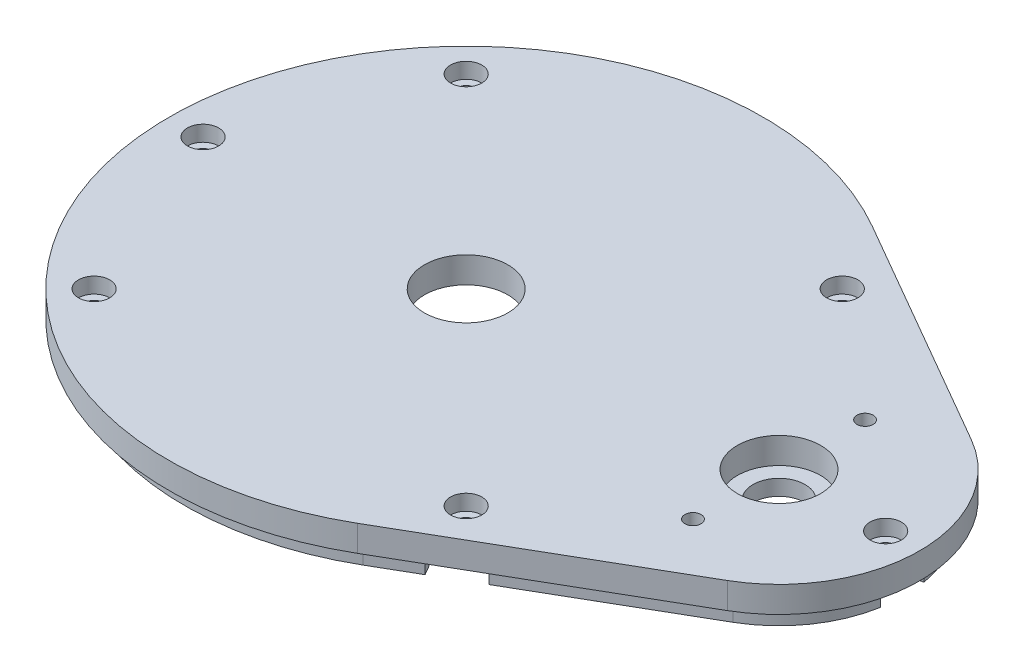
from build123d import *

# Parameters (mm, degrees)
SKETCH1_R           = 8
SKETCH1_R_2         = 1.55
BOSS_EXTRUDE1_DEPTH = 5
SKETCH2_R           = 12
SKETCH2_R_2         = 5
BOSS_EXTRUDE2_DEPTH = 3
BOSS_EXTRUDE3_DEPTH = 4
SKETCH5_R           = 1.55
CUT_EXTRUDE1_DEPTH  = 5
SKETCH6_R           = 3
CUT_EXTRUDE2_DEPTH  = 3


with BuildPart() as part:
    # Sketch1 → Boss-Extrude1 (new body)
    with BuildSketch(Plane(origin=(0, 0, 0), x_dir=(1, 0, 0), z_dir=(0, 1, 0))):
        with BuildLine():
            Line((13.5, -49.363448016), (58.5, -23.382685902))
            ThreePointArc((58.5, -23.382685902), (72, 0), (58.5, 23.382685902))
            Line((58.5, 23.382685902), (13.5, 49.363448016))
            ThreePointArc((13.5, 49.363448016), (-72, 0), (13.5, -49.363448016))
        make_face()
        with Locations((-15, 0)):
            Circle(SKETCH1_R, mode=Mode.SUBTRACT)
        with Locations((45, 0)):
            Circle(SKETCH1_R, mode=Mode.SUBTRACT)
        with Locations((45, 16.5)):
            Circle(SKETCH1_R_2, mode=Mode.SUBTRACT)
        with Locations((45, -16.5)):
            Circle(SKETCH1_R_2, mode=Mode.SUBTRACT)
    extrude(amount=BOSS_EXTRUDE1_DEPTH)

    # Sketch2 → Boss-Extrude2 (add)
    with BuildSketch(Plane.XZ):
        with Locations((45, 0)):
            Circle(SKETCH2_R)
        with Locations((45, 0)):
            Circle(SKETCH2_R_2, mode=Mode.SUBTRACT)
    extrude(amount=BOSS_EXTRUDE2_DEPTH)

    # Sketch4 → Boss-Extrude3 (add)
    with BuildSketch(Plane.XZ):
        with BuildLine():
            Line((12, -46.765371804), (19.534222953, -42.415486154))
            Line((19.534222953, -42.415486154), (18.534222953, -40.683435347))
            Line((18.534222953, -40.683435347), (11, -45.033320997))
            ThreePointArc((11, -45.033320997), (-19.532098623, -51.802124301), (-48.424955704, -39.834311042))
            Line((-48.424955704, -39.834311042), (-49.710530923, -41.366399928))
            ThreePointArc((-49.710530923, -41.366399928), (-19.706410108, -53.794513697), (12, -46.765371804))
        make_face()
        with BuildLine():
            Line((68.635386072, -4.167556264), (66.665770566, -3.820259909))
            ThreePointArc((66.665770566, -3.820259909), (63.021344974, -12.6186816), (56, -19.052558883))
            Line((56, -19.052558883), (26.328451587, -36.183435347))
            Line((26.328451587, -36.183435347), (27.328451587, -37.915486154))
            Line((27.328451587, -37.915486154), (57, -20.784609691))
            ThreePointArc((57, -20.784609691), (64.659649063, -13.765834472), (68.635386072, -4.167556264))
        make_face()
        with BuildLine():
            Line((66.665770566, 3.820259909), (68.635386072, 4.167556264))
            ThreePointArc((68.635386072, 4.167556264), (64.659649063, 13.765834472), (57, 20.784609691))
            Line((57, 20.784609691), (27.328451587, 37.915486154))
            Line((27.328451587, 37.915486154), (26.328451587, 36.183435347))
            Line((26.328451587, 36.183435347), (56, 19.052558883))
            ThreePointArc((56, 19.052558883), (63.021344974, 12.6186816), (66.665770566, 3.820259909))
        make_face()
        with BuildLine():
            Line((-49.710530923, 41.366399928), (-48.424955704, 39.834311042))
            ThreePointArc((-48.424955704, 39.834311042), (-19.532098623, 51.802124301), (11, 45.033320997))
            Line((11, 45.033320997), (18.534222953, 40.683435347))
            Line((18.534222953, 40.683435347), (19.534222953, 42.415486154))
            Line((19.534222953, 42.415486154), (12, 46.765371804))
            ThreePointArc((12, 46.765371804), (-19.706410108, 53.794513697), (-49.710530923, 41.366399928))
        make_face()
        with BuildLine():
            Line((-54.834311042, 33.424955704), (-56.366399928, 34.710530923))
            ThreePointArc((-56.366399928, 34.710530923), (-64.889494756, 20.664905348), (-68.794513697, 4.706410108))
            Line((-68.794513697, 4.706410108), (-66.802124301, 4.532098623))
            ThreePointArc((-66.802124301, 4.532098623), (-63.041735691, 19.899538483), (-54.834311042, 33.424955704))
        make_face()
        with BuildLine():
            Line((-68.794513697, -4.706410109), (-66.802124301, -4.532098623))
            ThreePointArc((-66.802124301, -4.532098623), (-63.041735691, -19.899538483), (-54.834311042, -33.424955704))
            Line((-54.834311042, -33.424955704), (-56.366399928, -34.710530923))
            ThreePointArc((-56.366399928, -34.710530923), (-64.889494756, -20.664905348), (-68.794513697, -4.706410109))
        make_face()
    extrude(amount=BOSS_EXTRUDE3_DEPTH)

    # Sketch5 → Cut-Extrude1 (cut)
    with BuildSketch(Plane(origin=(0, 5, 0), x_dir=(1, 0, 0), z_dir=(0, 1, 0))):
        with Locations((-65.45, 0)):
            Circle(SKETCH5_R)
        with Locations((65.45, 0)):
            Circle(SKETCH5_R)
        with Locations((-50.673537111, -35.673537111)):
            Circle(SKETCH5_R)
        with Locations((21.062445841, 36.062445841)):
            Circle(SKETCH5_R)
        with Locations((21.062445841, -36.062445841)):
            Circle(SKETCH5_R)
        with Locations((-50.673537111, 35.673537111)):
            Circle(SKETCH5_R)
    extrude(amount=-CUT_EXTRUDE1_DEPTH, mode=Mode.SUBTRACT)

    # Sketch6 → Cut-Extrude2 (cut)
    with BuildSketch(Plane(origin=(0, 5, 0), x_dir=(1, 0, 0), z_dir=(0, 1, 0))):
        with Locations((-50.673537111, 35.673537111)):
            Circle(SKETCH6_R)
        with Locations((-65.45, 0)):
            Circle(SKETCH6_R)
        with Locations((-50.673537111, -35.673537111)):
            Circle(SKETCH6_R)
        with Locations((21.062445841, -36.062445841)):
            Circle(SKETCH6_R)
        with Locations((21.062445841, 36.062445841)):
            Circle(SKETCH6_R)
        with Locations((65.45, 0)):
            Circle(SKETCH6_R)
    extrude(amount=-CUT_EXTRUDE2_DEPTH, mode=Mode.SUBTRACT)


solid = part.part
